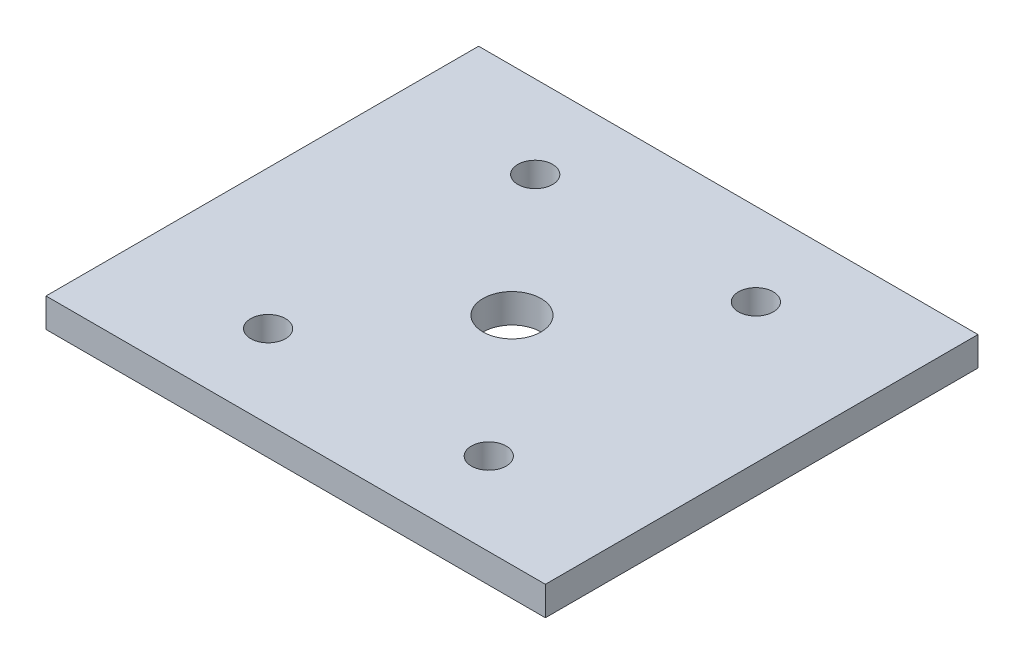
from build123d import *

# Parameters (mm, degrees)
SKETCH7_W          = 172
SKETCH7_H          = 149
BASE_FLANGE2_DEPTH = 10
SKETCH8_R          = 6
SKETCH8_R_2        = 10
CUT_EXTRUDE1_DEPTH = 200.974998437


# Sheet-metal steps are written as plain solids
with BuildPart() as part:
    # Sketch7 → Base-Flange2 (new body)
    with BuildSketch(Plane(origin=(0, 0, 0), x_dir=(1, 0, 0), z_dir=(0, 1, 0))):
        with Locations((47, 74.5)):
            Rectangle(SKETCH7_W, SKETCH7_H)
    extrude(amount=-BASE_FLANGE2_DEPTH)

    # Sketch8 → Cut-Extrude1 (cut, through all)
    with BuildSketch(Plane(origin=(0, 0, 0), x_dir=(1, 0, 0), z_dir=(0, 1, 0))):
        with Locations(Location((9, 120.5, 0), (0, 0, 270))):
            Circle(SKETCH8_R)
        with Locations(Location((85, 120.5, 0), (0, 0, 270))):
            Circle(SKETCH8_R)
        with Locations(Location((9, 28.5, 0), (0, 0, 270))):
            Circle(SKETCH8_R)
        with Locations(Location((47, 74.5, 0), (0, 0, 270))):
            Circle(SKETCH8_R_2)
        with Locations(Location((85, 28.5, 0), (0, 0, 270))):
            Circle(SKETCH8_R)
    extrude(amount=-CUT_EXTRUDE1_DEPTH, mode=Mode.SUBTRACT)


solid = part.part
